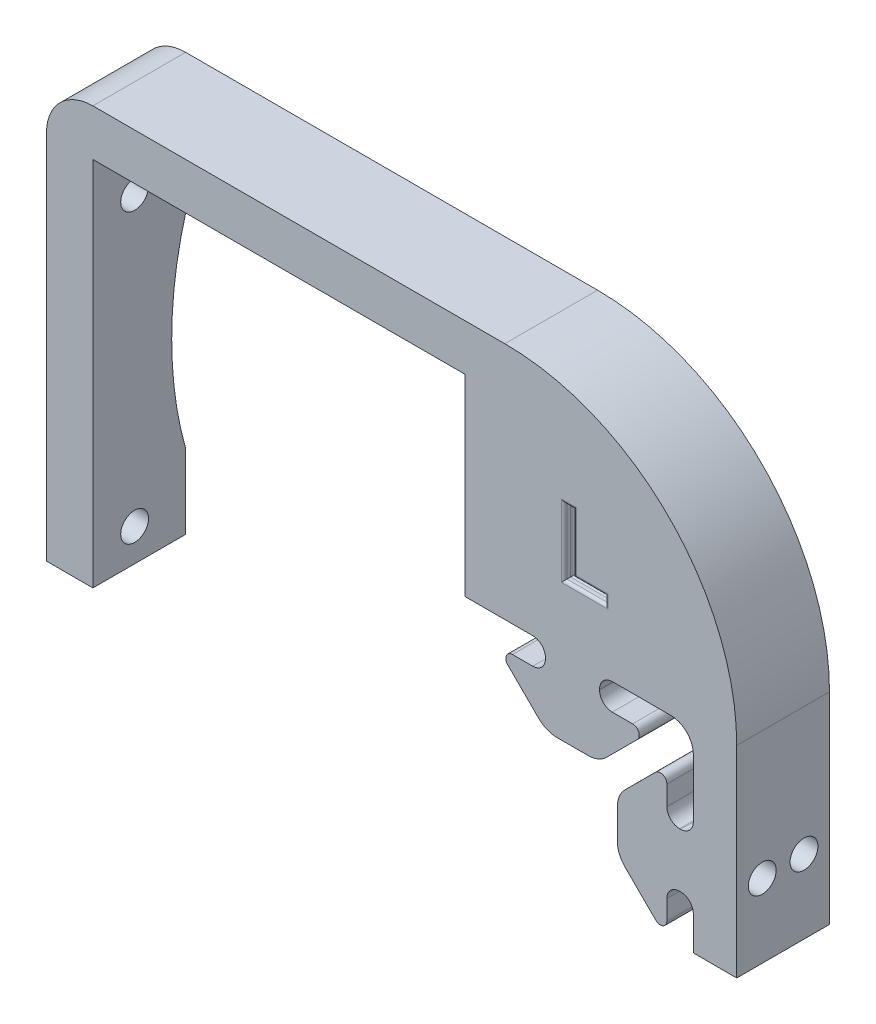
from build123d import *

# Parameters (mm, degrees)
BOSS_EXTRUDE1_DEPTH = 10
CUT_EXTRUDE1_REACH  = 86.489
SKETCH2_R           = 1.5
FILLET3_R           = 5
CUT_EXTRUDE2_REACH  = 86.489
SKETCH3_R           = 1.5
FILLET4_R           = 25
CUT_EXTRUDE7_DEPTH  = 1
FILLET8_R           = 0.3
SKETCH8_W           = 10
SKETCH8_H           = 20.75
BOSS_EXTRUDE2_DEPTH = 1
SKETCH10_W          = 4
SKETCH10_H          = 22
CUT_EXTRUDE9_DEPTH  = 1.5
FILLET10_R          = 40


with BuildPart() as part:
    # Sketch1 → Boss-Extrude1 (new body)
    with BuildSketch(Plane.XY):
        with BuildLine():
            Line((13.02, -7.9417418), (17.7, -7.9417418))
            Line((17.7, -7.9417418), (17.7, 38.77))
            Line((17.7, 38.77), (-56.7, 38.77))
            Line((-56.7, 38.77), (-56.7, -6.23))
            Line((-56.7, -6.23), (-51.7, -6.23))
            Line((-51.7, -6.23), (-51.7, 33.77))
            Line((-51.7, 33.77), (-10.566443095, 33.77))
            Line((-10.566443095, 33.77), (-10.566443095, 13.02))
            Line((-10.566443095, 13.02), (-5.317126718, 13.02))
            Line((-5.317126718, 13.02), (-4.287512407, 13.02))
            ThreePointArc((-4.287512407, 13.02), (-3.319474451, 12.619025549), (-2.9185, 11.650987593))
            Line((-2.9185, 11.650987593), (-2.9185, 11.539212407))
            ThreePointArc((-2.9185, 11.539212407), (-3.319474451, 10.571174451), (-4.287512407, 10.1702))
            Line((-4.287512407, 10.1702), (-6.476788598, 10.1702))
            ThreePointArc((-6.476788598, 10.1702), (-7.136510935, 9.729114651), (-6.981020848, 8.950903446))
            Line((-6.981020848, 8.950903446), (-3.672257405, 5.649701928))
            ThreePointArc((-3.672257405, 5.649701928), (-2.746830644, 5.032499411), (-1.655778399, 4.8158))
            Line((-1.655778399, 4.8158), (1.655778399, 4.8158))
            ThreePointArc((1.655778399, 4.8158), (2.746830644, 5.032499411), (3.672257405, 5.649701928))
            Line((3.672257405, 5.649701928), (6.981020848, 8.950903446))
            ThreePointArc((6.981020848, 8.950903446), (7.136510935, 9.729114651), (6.476788598, 10.1702))
            Line((6.476788598, 10.1702), (4.287512407, 10.1702))
            ThreePointArc((4.287512407, 10.1702), (3.319474451, 10.571174451), (2.9185, 11.539212407))
            Line((2.9185, 11.539212407), (2.9185, 11.650987593))
            ThreePointArc((2.9185, 11.650987593), (3.319474451, 12.619025549), (4.287512407, 13.02))
            Line((4.287512407, 13.02), (6.332886163, 13.02))
            Line((6.332886163, 13.02), (10.562594215, 13.019824354))
            ThreePointArc((10.562594215, 13.019824354), (12.303594776, 12.313982883), (13.019956614, 10.577284622))
            Line((13.019956614, 10.577284622), (13.02, 4.287469289))
            ThreePointArc((13.02, 4.287469289), (12.619025549, 3.319431332), (11.650987593, 2.918456882))
            Line((11.650987593, 2.918456882), (11.539212407, 2.918456882))
            ThreePointArc((11.539212407, 2.918456882), (10.571174451, 3.319431332), (10.1702, 4.287469289))
            Line((10.1702, 4.287469289), (10.1702, 6.402089023))
            ThreePointArc((10.1702, 6.402089023), (9.733877283, 7.055496588), (8.963146507, 6.90287605))
            Line((8.963146507, 6.90287605), (5.667020993, 3.614283579))
            ThreePointArc((5.667020993, 3.614283579), (5.046449321, 2.687255303), (4.8285, 1.593185507))
            Line((4.8285, 1.593185507), (4.8285, -1.593185507))
            ThreePointArc((4.8285, -1.593185507), (5.046449321, -2.687255303), (5.667020993, -3.614283579))
            Line((5.667020993, -3.614283579), (8.963146507, -6.90287605))
            ThreePointArc((8.963146507, -6.90287605), (9.733877283, -7.055496588), (10.1702, -6.402089023))
            Line((10.1702, -6.402089023), (10.1702, -4.287469289))
            ThreePointArc((10.1702, -4.287469289), (10.571174451, -3.319431332), (11.539212407, -2.918456882))
            Line((11.539212407, -2.918456882), (11.650987593, -2.918456882))
            ThreePointArc((11.650987593, -2.918456882), (12.619025549, -3.319431332), (13.02, -4.287469289))
            Line((13.02, -4.287469289), (13.02, -5.3170836))
            Line((13.02, -5.3170836), (13.02, -7.9417418))
        make_face()
    extrude(amount=BOSS_EXTRUDE1_DEPTH)

    # Sketch2 → Cut-Extrude1 (cut, up to next)
    with BuildSketch(Plane.ZY.offset(56.7), mode=Mode.PRIVATE) as cut_extrude1_sk1:
        with Locations((5.5, -2.73)):
            Circle(SKETCH2_R)
    cut_extrude1_tool1 = extrude(cut_extrude1_sk1.sketch, amount=-CUT_EXTRUDE1_REACH, mode=Mode.PRIVATE) & part.part
    # Sketch2 → Cut-Extrude1 (cut, up to next)
    with BuildSketch(Plane.ZY.offset(56.7), mode=Mode.PRIVATE) as cut_extrude1_sk2:
        with Locations((5.5, 28.27)):
            Circle(SKETCH2_R)
    cut_extrude1_tool2 = extrude(cut_extrude1_sk2.sketch, amount=-CUT_EXTRUDE1_REACH, mode=Mode.PRIVATE) & part.part
    add(cut_extrude1_tool1.solids().sort_by_distance((-56.7, -2.73, 5.5))[0], mode=Mode.SUBTRACT)
    add(cut_extrude1_tool2.solids().sort_by_distance((-56.7, 28.27, 5.5))[0], mode=Mode.SUBTRACT)

    # Fillet3
    fillet3_edges = [part.edges().sort_by_distance(p)[0] for p in [
        (-56.7, 38.77, 5),
    ]]
    fillet(fillet3_edges, radius=FILLET3_R)

    # Sketch3 → Cut-Extrude2 (cut, up to next)
    with BuildSketch(Plane(origin=(17.7, 0, 0), x_dir=(0, 0, -1), z_dir=(1, 0, 0)), mode=Mode.PRIVATE) as cut_extrude2_sk1:
        with Locations((-7.25, 0)):
            Circle(SKETCH3_R)
    cut_extrude2_tool1 = extrude(cut_extrude2_sk1.sketch, amount=-CUT_EXTRUDE2_REACH, mode=Mode.PRIVATE) & part.part
    # Sketch3 → Cut-Extrude2 (cut, up to next)
    with BuildSketch(Plane(origin=(17.7, 0, 0), x_dir=(0, 0, -1), z_dir=(1, 0, 0)), mode=Mode.PRIVATE) as cut_extrude2_sk2:
        with Locations(Location((-2.75, 0, 0), (0, 0, 90))):
            Circle(SKETCH3_R)
    cut_extrude2_tool2 = extrude(cut_extrude2_sk2.sketch, amount=-CUT_EXTRUDE2_REACH, mode=Mode.PRIVATE) & part.part
    add(cut_extrude2_tool1.solids().sort_by_distance((17.7, 0, 7.25))[0], mode=Mode.SUBTRACT)
    add(cut_extrude2_tool2.solids().sort_by_distance((17.7, 0, 2.75))[0], mode=Mode.SUBTRACT)

    # Fillet4
    fillet4_edges = [part.edges().sort_by_distance(p)[0] for p in [
        (17.7, 38.77, 5),
    ]]
    fillet(fillet4_edges, radius=FILLET4_R)

    # Sketch7 → Cut-Extrude7 (cut)
    with BuildSketch(Plane.XY.offset(10)):
        Polygon((-0.90100078, 19.84300121), (-0.90100078, 27.034293528), (0.113155829, 27.034293528), (0.113155829, 20.672765708), (3.524409877, 20.672765708), (3.524409877, 19.84300121), align=None)
    extrude(amount=-CUT_EXTRUDE7_DEPTH, mode=Mode.SUBTRACT)

    # Fillet8
    fillet8_edges = [part.edges().sort_by_distance(p)[0] for p in [
        (1.311704549, 19.84300121, 10),
        (-0.90100078, 23.438647369, 10),
        (-0.393922475, 27.034293528, 10),
        (0.113155829, 23.853529618, 10),
        (1.818782853, 20.672765708, 10),
        (3.524409877, 20.257883459, 10),
        (1.311704549, 19.84300121, 9),
        (-0.90100078, 23.438647369, 9),
        (-0.393922475, 27.034293528, 9),
        (0.113155829, 23.853529618, 9),
        (1.818782853, 20.672765708, 9),
        (3.524409877, 20.257883459, 9),
    ]]
    fillet(fillet8_edges, radius=FILLET8_R)

    # Sketch8 → Boss-Extrude2 (add)
    with BuildSketch(Plane.ZY.offset(10.566443095)):
        with Locations((5, 23.395)):
            Rectangle(SKETCH8_W, SKETCH8_H)
    extrude(amount=BOSS_EXTRUDE2_DEPTH)

    # Sketch10 → Cut-Extrude9 (cut)
    with BuildSketch(Plane(origin=(0, 0, 0), x_dir=(-1, 0, 0), z_dir=(0, 0, -1))):
        with Locations((51.7, 12.77)):
            Rectangle(SKETCH10_W, SKETCH10_H)
    extrude(amount=-CUT_EXTRUDE9_DEPTH, mode=Mode.SUBTRACT)

    # Fillet10
    # the kernel refuses this fillet: 40 mm, written as the material it adds along each edge
    with BuildSketch(Plane(origin=(-51.7, 1.77, 1.5), x_dir=(0, 0, -1), z_dir=(-1, 0, 0))) as fillet10_piece_1:
        with BuildLine():
            CenterArc((40, -10.851267207), FILLET10_R, 164.259451475, 15.740548525)
            Line((0, -10.851267207), (0, 0))
            Line((0, 0), (1.5, 0))
        make_face()
    extrude(amount=2)
    with BuildSketch(Plane(origin=(-53.7, 23.77, 1.5), x_dir=(0, -1, 0), z_dir=(1, 0, 0))) as fillet10_piece_2:
        with BuildLine():
            CenterArc((10.851267207, 40), FILLET10_R, 254.259451475, 15.740548525)
            Line((0, 1.5), (0, 0))
            Line((0, 0), (10.851267207, 0))
        make_face()
    extrude(amount=2)


solid = part.part
